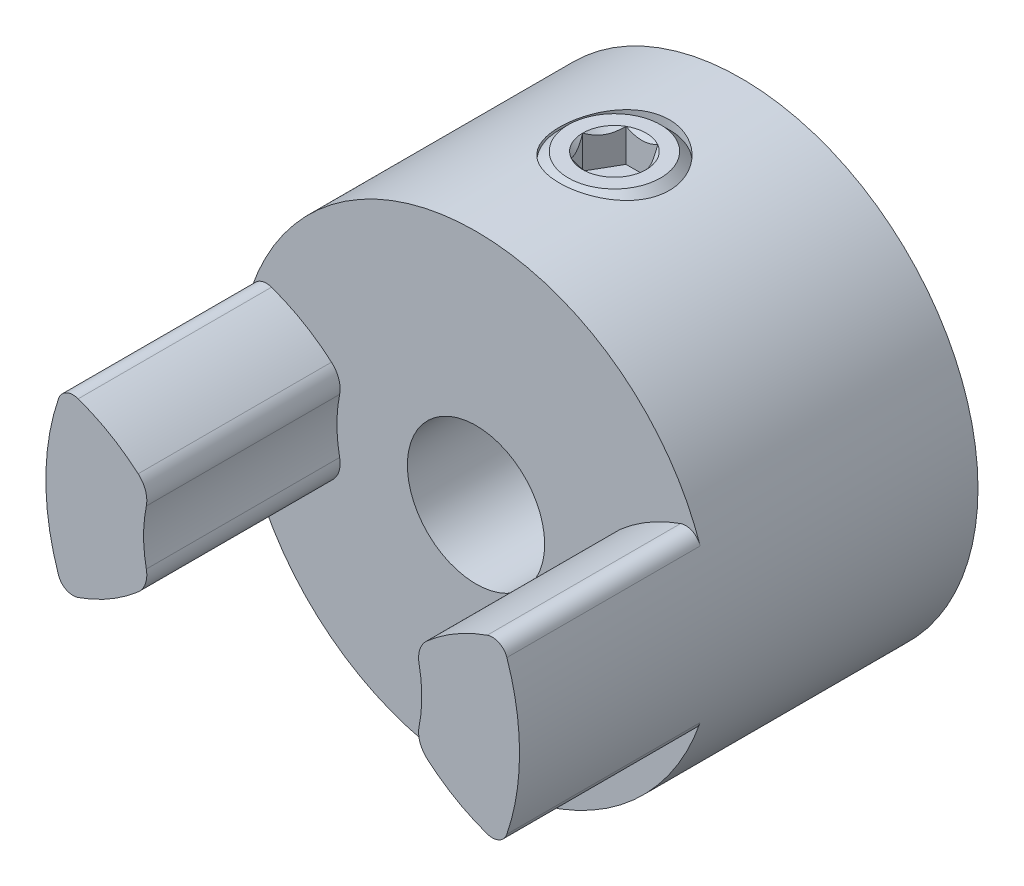
from build123d import *
from OCP.BRepFilletAPI import BRepFilletAPI_MakeChamfer

# Parameters (mm, degrees)
BOSS_EXTRUDE1_START     = -5.953125
SKETCH1_R               = 13.6921875
BOSS_EXTRUDE1_DEPTH     = 15.875
BOSS_EXTRUDE5_START     = 11.176
BOSS_EXTRUDE5_DEPTH     = 11.176
MOVE_START              = -5.953125
MOVE_FACE1_DEPTH        = 11.176
MOVE_FACE1_2_DEPTH      = 11.176
CIRPATTERN3_START       = -5.953125
CIRPATTERN3_DEPTH       = 11.176
CUT_EXTRUDE5_DEPTH      = 30.179085628
CUT_EXTRUDE5_DEPTH_BACK = 30.179085628
SKETCH15_R              = 3.96875
CHAMFER1_SIZE           = 0.5476875
CHAMFER1_SIZE2          = 0.81198011
SKETCH5_R               = 3.175
CUT_EXTRUDE2_DEPTH      = 30.179085628
SKETCH6_R               = 3.175
BOSS_EXTRUDE3_DEPTH     = 7.9375
CUT_EXTRUDE3_DEPTH      = 1.905
CHAMFER3_SIZE           = 0.508
CHAMFER4_SIZE           = 1.0795


# Read off the part's stored shape, not the designer's step: Move Face1, CirPattern3
with BuildPart() as part:
    # Sketch1 → Boss-Extrude1 (new body)
    with BuildSketch(Plane.XY.offset(BOSS_EXTRUDE1_START)):
        Circle(SKETCH1_R)
    extrude(amount=-BOSS_EXTRUDE1_DEPTH)

    # Sketch11 → Boss-Extrude5 (add)
    with BuildSketch(Plane.XY.offset(-5.953125).offset(BOSS_EXTRUDE5_START)):
        with BuildLine():
            ThreePointArc((-1.582501, -7.883505579), (-0.004369034, -8.040686324), (1.573762932, -7.883505579))
            ThreePointArc((1.573762932, -7.883505579), (2.326569083, -7.932638836), (2.952339417, -8.353996958))
            ThreePointArc((2.952339417, -8.353996958), (4.124174772, -9.993538922), (4.969226713, -11.823069782))
            ThreePointArc((4.969226713, -11.823069782), (4.930575443, -12.50660364), (4.417578974, -12.959976641))
            ThreePointArc((4.417578974, -12.959976641), (-0.006979455, -13.692185721), (-4.430789112, -12.955466274))
            ThreePointArc((-4.430789112, -12.955466274), (-4.941191352, -12.503649266), (-4.979409431, -11.823069782))
            ThreePointArc((-4.979409431, -11.823069782), (-4.13390788, -9.993483356), (-2.961583815, -8.353996958))
            ThreePointArc((-2.961583815, -8.353996958), (-2.335546152, -7.932611995), (-1.582501, -7.883505579))
        make_face()
    extrude(amount=-BOSS_EXTRUDE5_DEPTH)

    # Move Face1 outline → Move Face1 (cut)
    with BuildSketch(Plane.XY.offset(MOVE_START)):
        with BuildLine():
            ThreePointArc((-4.430789112, -12.955466274), (-0.006979455, -13.692185721), (4.417578974, -12.959976641))
            ThreePointArc((4.417578974, -12.959976641), (4.930575443, -12.50660364), (4.969226713, -11.823069782))
            ThreePointArc((4.969226713, -11.823069782), (4.124174772, -9.993538922), (2.952339417, -8.353996958))
            ThreePointArc((2.952339417, -8.353996958), (2.326569083, -7.932638836), (1.573762932, -7.883505579))
            ThreePointArc((1.573762932, -7.883505579), (-0.004369034, -8.040686324), (-1.582501, -7.883505579))
            ThreePointArc((-1.582501, -7.883505579), (-2.335546152, -7.932611995), (-2.961583815, -8.353996958))
            ThreePointArc((-2.961583815, -8.353996958), (-4.13390788, -9.993483356), (-4.979409431, -11.823069782))
            ThreePointArc((-4.979409431, -11.823069782), (-4.941191352, -12.503649266), (-4.430789112, -12.955466274))
        make_face()
    extrude(amount=MOVE_FACE1_DEPTH, mode=Mode.SUBTRACT)

    # Move Face1 2 outline → Move Face1 2 (add)
    with BuildSketch(Plane.XY.offset(MOVE_START)):
        with BuildLine():
            ThreePointArc((7.883505579, -1.582501), (7.932611995, -2.335546152), (8.353996958, -2.961583815))
            ThreePointArc((8.353996958, -2.961583815), (9.993483356, -4.13390788), (11.823069782, -4.979409431))
            ThreePointArc((11.823069782, -4.979409431), (12.503649266, -4.941191352), (12.955466274, -4.430789112))
            ThreePointArc((12.955466274, -4.430789112), (13.692185721, -0.006979455), (12.959976641, 4.417578974))
            ThreePointArc((12.959976641, 4.417578974), (12.50660364, 4.930575443), (11.823069782, 4.969226713))
            ThreePointArc((11.823069782, 4.969226713), (9.993538922, 4.124174772), (8.353996958, 2.952339417))
            ThreePointArc((8.353996958, 2.952339417), (7.932638836, 2.326569083), (7.883505579, 1.573762932))
            ThreePointArc((7.883505579, 1.573762932), (8.040686324, -0.004369034), (7.883505579, -1.582501))
        make_face()
    extrude(amount=MOVE_FACE1_2_DEPTH)

    # CirPattern3 outline → CirPattern3 (add)
    with BuildSketch(Plane.XY.offset(CIRPATTERN3_START)):
        with BuildLine():
            ThreePointArc((-7.883505579, 1.582501), (-7.932611995, 2.335546152), (-8.353996958, 2.961583815))
            ThreePointArc((-8.353996958, 2.961583815), (-9.993483356, 4.13390788), (-11.823069782, 4.979409431))
            ThreePointArc((-11.823069782, 4.979409431), (-12.503649266, 4.941191352), (-12.955466274, 4.430789112))
            ThreePointArc((-12.955466274, 4.430789112), (-13.692185721, 0.006979455), (-12.959976641, -4.417578974))
            ThreePointArc((-12.959976641, -4.417578974), (-12.50660364, -4.930575443), (-11.823069782, -4.969226713))
            ThreePointArc((-11.823069782, -4.969226713), (-9.993538922, -4.124174772), (-8.353996958, -2.952339417))
            ThreePointArc((-8.353996958, -2.952339417), (-7.932638836, -2.326569083), (-7.883505579, -1.573762932))
            ThreePointArc((-7.883505579, -1.573762932), (-8.040686324, 0.004369034), (-7.883505579, 1.582501))
        make_face()
    extrude(amount=CIRPATTERN3_DEPTH)

    # Sketch15 → Cut-Extrude5 (cut, two sides: drawn at the far end of the back side and taken through both)
    with BuildSketch(Plane.XY.offset(-CUT_EXTRUDE5_DEPTH_BACK)):
        Circle(SKETCH15_R)
    extrude(amount=CUT_EXTRUDE5_DEPTH + CUT_EXTRUDE5_DEPTH_BACK, mode=Mode.SUBTRACT)

    # Chamfer1: one chamfer whose edges measure the first distance from different faces: ONE call of the kernel's chamfer builder (chamfer() names one face for all edges)
    chamfer1_edges_1 = [part.edges().sort_by_distance(p)[0] for p in [
        (-13.6921875, 0, -21.828125),
    ]]
    chamfer1_side_1 = [part.faces().sort_by_distance(p)[0] for p in [
        (-13.6921875, 0, -13.890625),
    ]]
    chamfer1_edges_2 = [part.edges().sort_by_distance(p)[0] for p in [
        (-3.96875, 0, -21.828125),
    ]]
    chamfer1_side_2 = [part.faces().sort_by_distance(p)[0] for p in [
        (-3.96875, 0, -13.890625),
    ]]
    chamfer1 = BRepFilletAPI_MakeChamfer(part.part.solid().wrapped)
    for e in chamfer1_edges_1:
        chamfer1.Add(CHAMFER1_SIZE, CHAMFER1_SIZE2, e.wrapped, chamfer1_side_1[0].wrapped)  # the first distance lies on this face
    for e in chamfer1_edges_2:
        chamfer1.Add(CHAMFER1_SIZE, CHAMFER1_SIZE2, e.wrapped, chamfer1_side_2[0].wrapped)  # the first distance lies on this face
    add(Compound.cast(chamfer1.Shape()), mode=Mode.REPLACE)

    # Sketch5 → Cut-Extrude2 (cut, through all)
    with BuildSketch(Plane(origin=(0, 0, 0), x_dir=(1, 0, 0), z_dir=(0, 1, 0))):
        with Locations(Location((0, 13.954125, 0), (0, 0, 90))):
            Circle(SKETCH5_R)
    extrude(amount=CUT_EXTRUDE2_DEPTH, mode=Mode.SUBTRACT)


with BuildPart() as body_2:
    # Sketch6 → Boss-Extrude3 (new body)
    with BuildSketch(Plane(origin=(0, 13.6921875, 0), x_dir=(-1, 0, 0), z_dir=(0, 1, 0))):
        with Locations(Location((0, -13.954125, 0), (0, 0, 90))):
            Circle(SKETCH6_R)
    extrude(amount=-BOSS_EXTRUDE3_DEPTH)

    # Sketch8 → Cut-Extrude3 (cut)
    with BuildSketch(Plane(origin=(0, 13.6921875, 0), x_dir=(1, 0, 0), z_dir=(0, 1, 0))):
        Polygon((0.916543552, 12.366625), (1.833087105, 13.954125), (0.916543552, 15.541625), (-0.916543552, 15.541625), (-1.833087105, 13.954125), (-0.916543552, 12.366625), align=None)
    extrude(amount=-CUT_EXTRUDE3_DEPTH, mode=Mode.SUBTRACT)

    # Cut-Extrude4 cone 1 section (through the dimple's axis) → Cut-Extrude4 (revolve, cut)
    with BuildSketch(Plane(origin=(0, 13.6921875, -13.954125), x_dir=(0, 0, 1), z_dir=(1, 0, 0))):
        Polygon((0, 0), (1.833087105, 0), (0, 1.833087105), align=None)
    revolve(axis=Axis((0, 13.6921875, -13.954125), (0, -1, 0)), mode=Mode.SUBTRACT)

    # Chamfer3
    chamfer3_edges = [body_2.edges().sort_by_distance(p)[0] for p in [
        (0, 13.6921875, -17.129125),
    ]]
    chamfer(chamfer3_edges, length=CHAMFER3_SIZE)

    # Chamfer4
    chamfer4_edges = [body_2.edges().sort_by_distance(p)[0] for p in [
        (0, 5.7546875, -17.129125),
    ]]
    chamfer(chamfer4_edges, length=CHAMFER4_SIZE)


solid = Compound([part.part, body_2.part])
